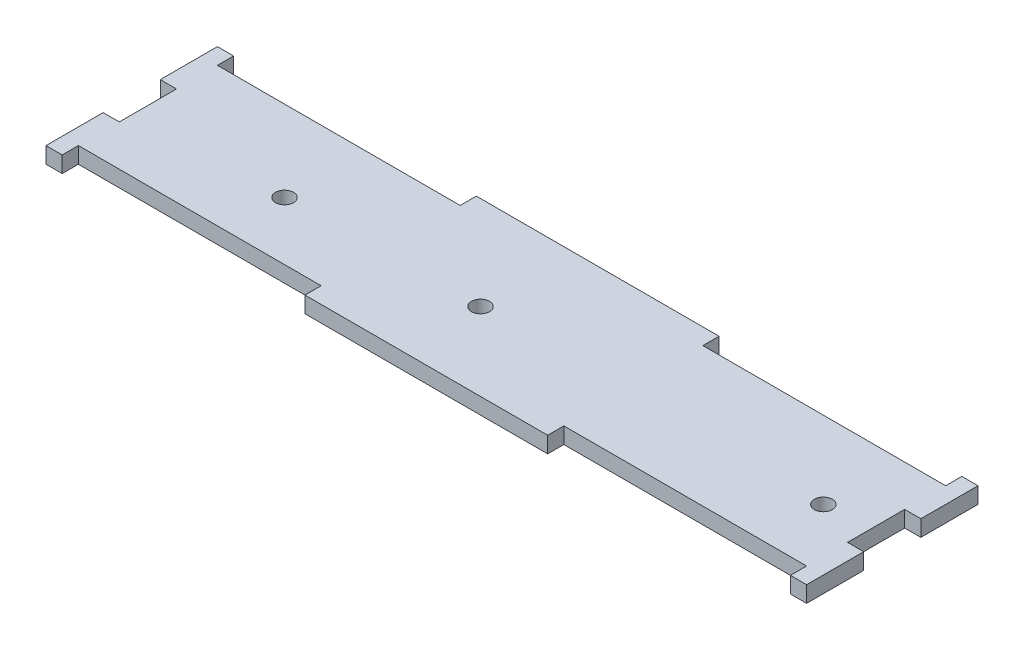
from build123d import *

# Parameters (mm, degrees)
SKETCH1_R           = 1.5
BOSS_EXTRUDE1_DEPTH = 2.7


with BuildPart() as part:
    # Sketch1 → Boss-Extrude1 (new body)
    with BuildSketch(Plane(origin=(0, 0, 0), x_dir=(1, 0, 0), z_dir=(0, 1, 0))):
        Polygon((6.7, 2.833333333), (4, 2.833333333), (4, 12.366666667), (6.7, 12.366666667), (6.7, 21.9), (4, 21.9), (4, 19.2), (-36.5, 19.2), (-36.5, 21.9), (-77, 21.9), (-77, 19.2), (-117.5, 19.2), (-117.5, 21.9), (-120.2, 21.9), (-120.2, 12.366666667), (-117.5, 12.366666667), (-117.5, 2.833333333), (-120.2, 2.833333333), (-120.2, -6.7), (-117.5, -6.7), (-117.5, -4), (-77, -4), (-77, -6.7), (-36.5, -6.7), (-36.5, -4), (4, -4), (4, -6.7), (6.7, -6.7), align=None)
        with Locations((-92.8, 5.7)):
            Circle(SKETCH1_R, mode=Mode.SUBTRACT)
        with Locations((-60.7, 6.3)):
            Circle(SKETCH1_R, mode=Mode.SUBTRACT)
        with Locations((-3.5, 6.3)):
            Circle(SKETCH1_R, mode=Mode.SUBTRACT)
    extrude(amount=BOSS_EXTRUDE1_DEPTH)


solid = part.part
